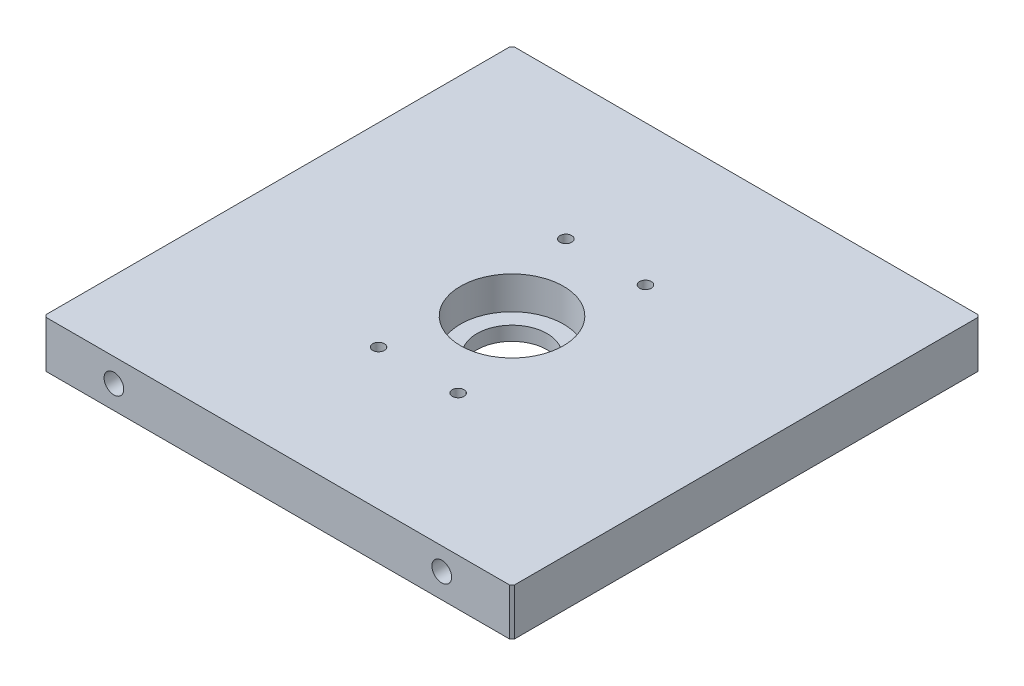
from build123d import *

# Parameters (mm, degrees)
BOSS_EXTRUDE1_DEPTH                  = 5
BOSS_EXTRUDE1_DEPTH_BACK             = 5
SKETCH1_W                            = 100
SKETCH1_H                            = 100
SKETCH1_R                            = 7.5
SKETCH2_R                            = 11
CUT_EXTRUDE1_DEPTH                   = 7
TAP_DRILL_FOR_M5X0_8_TAP1_AT_2_COUNT = 2
TAP_DRILL_FOR_M5X0_8_TAP1_AT_2_PITCH = 70.000402901
TAP_DRILL_FOR_M3X0_5_TAP2_D          = 2.5
TAP_DRILL_FOR_M3X0_5_TAP2_DEPTH      = 6
TAP_DRILL_FOR_M3X0_5_TAP2_TIP        = 0.751075774
CHAMFER1_SIZE                        = 0.5


with BuildPart() as part:
    # Sketch1 → Boss-Extrude1 (new, two sides: drawn at the far end of the back side and taken through both)
    with BuildSketch(Plane(origin=(0, 0, 0), x_dir=(1, 0, 0), z_dir=(0, 1, 0)).offset(-BOSS_EXTRUDE1_DEPTH_BACK)):
        Rectangle(SKETCH1_W, SKETCH1_H)
        Circle(SKETCH1_R, mode=Mode.SUBTRACT)
    extrude(amount=BOSS_EXTRUDE1_DEPTH + BOSS_EXTRUDE1_DEPTH_BACK)

    # Sketch2 → Cut-Extrude1 (cut)
    with BuildSketch(Plane(origin=(0, 5, 0), x_dir=(1, 0, 0), z_dir=(0, 1, 0))):
        Circle(SKETCH2_R)
    extrude(amount=-CUT_EXTRUDE1_DEPTH, mode=Mode.SUBTRACT)

    # Sketch6 → Tap Drill for M5x0.8 Tap1 (revolve, cut)
    with BuildSketch(Plane(origin=(-35, 0, 50), x_dir=(0, -1, 0), z_dir=(1, 0, 0))):
        Polygon((0, 0), (0, 11.2618073), (2.1, 10), (2.1, 0), align=None)
    tap_drill_for_m5x0_8_tap1 = revolve(axis=Axis((-35, 0, 56.35), (0, 0, -1)), mode=Mode.SUBTRACT)

    # Tap Drill for M5x0.8 Tap1 at 2: Tap Drill for M5x0.8 Tap1 ×2
    with Locations(*[Vector(0.9999942443098965, 0.0033928376146228614, 0) * (i * TAP_DRILL_FOR_M5X0_8_TAP1_AT_2_PITCH) for i in range(1, TAP_DRILL_FOR_M5X0_8_TAP1_AT_2_COUNT)]):
        add(tap_drill_for_m5x0_8_tap1, mode=Mode.SUBTRACT)

    # Mirror1: Tap Drill for M5x0.8 Tap1 across plane
    add(tap_drill_for_m5x0_8_tap1.mirror(Plane(origin=(0, 0, 0), x_dir=(1, 0, 0), z_dir=(0, 0, -1))), mode=Mode.SUBTRACT)

    # Mirror1 copy 1 sketch → Mirror1 copy 1 (revolve, cut)
    with BuildSketch(Plane(origin=(35, 0.2375, -50), x_dir=(0, -1, 0), z_dir=(1, 0, 0))):
        Polygon((0, 0), (0, -11.2618073), (2.1, -10), (2.1, 0), align=None)
    revolve(axis=Axis((35, 0.2375, -56.35), (0, 0, -1)), mode=Mode.SUBTRACT)

    # Tap Drill for M3x0.5 Tap2
    with Locations(Plane(origin=(0, 5, 0), x_dir=(1, 0, 0), z_dir=(0, 1, 0))):
        with Locations((-8.5, -20), (8.5, -20), (8.5, 20), (-8.5, 20)):
            Hole(TAP_DRILL_FOR_M3X0_5_TAP2_D / 2, depth=TAP_DRILL_FOR_M3X0_5_TAP2_DEPTH)
            with Locations((0, 0, -(TAP_DRILL_FOR_M3X0_5_TAP2_DEPTH + TAP_DRILL_FOR_M3X0_5_TAP2_TIP / 2))):  # 118° drill point
                Cone(0, TAP_DRILL_FOR_M3X0_5_TAP2_D / 2, TAP_DRILL_FOR_M3X0_5_TAP2_TIP, mode=Mode.SUBTRACT)

    # Chamfer1
    chamfer1_edges = [part.edges().sort_by_distance(p)[0] for p in [
        (-50, 0, -50),
        (-50, 0, 50),
        (50, 0, 50),
        (50, 0, -50),
    ]]
    chamfer(chamfer1_edges, length=CHAMFER1_SIZE)


solid = part.part
